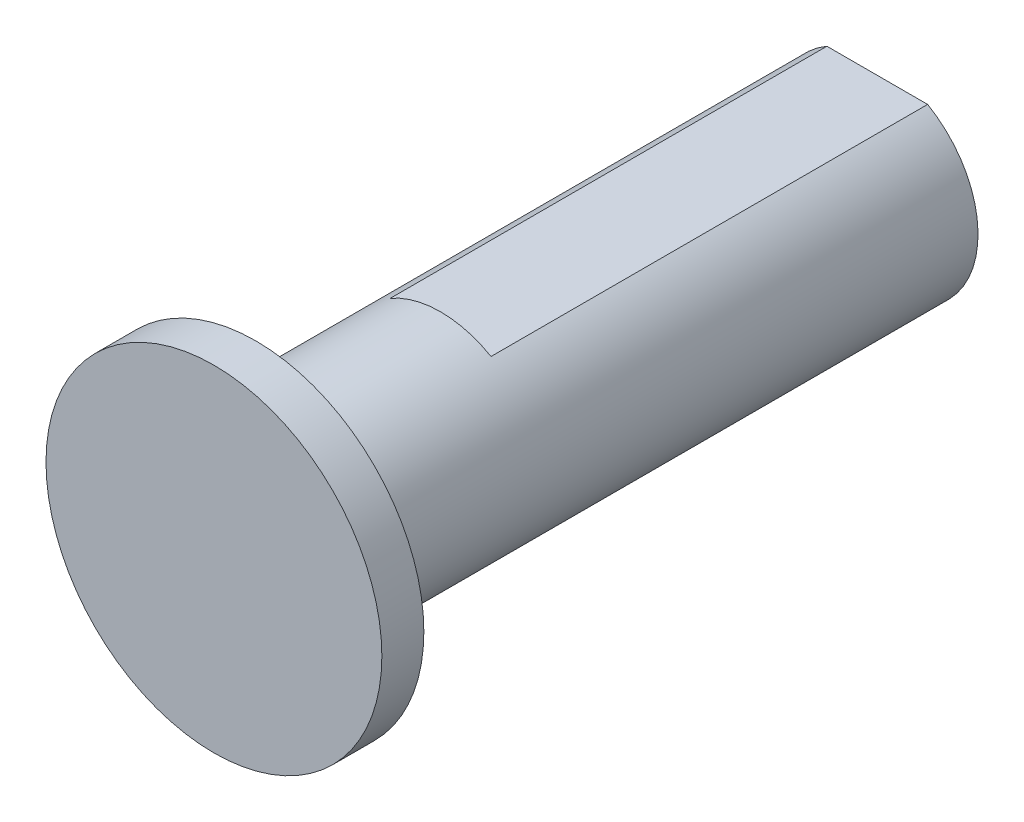
from build123d import *

# Parameters (mm, degrees)
SKETCH1_R           = 6
BOSS_EXTRUDE1_DEPTH = 37
CUT_EXTRUDE1_DEPTH  = 26
SKETCH3_R           = 10
BOSS_EXTRUDE2_DEPTH = 2.5


with BuildPart() as part:
    # Sketch1 → Boss-Extrude1 (new body)
    with BuildSketch(Plane.XY):
        Circle(SKETCH1_R)
    extrude(amount=BOSS_EXTRUDE1_DEPTH)

    # Sketch2 → Cut-Extrude1 (cut)
    with BuildSketch(Plane(origin=(0, 0, 0), x_dir=(-1, 0, 0), z_dir=(0, 0, -1))):
        with BuildLine():
            ThreePointArc((3, 5.196152423), (0, 6), (-3, 5.196152423))
            Line((-3, 5.196152423), (3, 5.196152423))
        make_face()
    extrude(amount=-CUT_EXTRUDE1_DEPTH, mode=Mode.SUBTRACT)

    # Sketch3 → Boss-Extrude2 (add)
    with BuildSketch(Plane.XY.offset(37)):
        Circle(SKETCH3_R)
    extrude(amount=BOSS_EXTRUDE2_DEPTH)


solid = part.part
